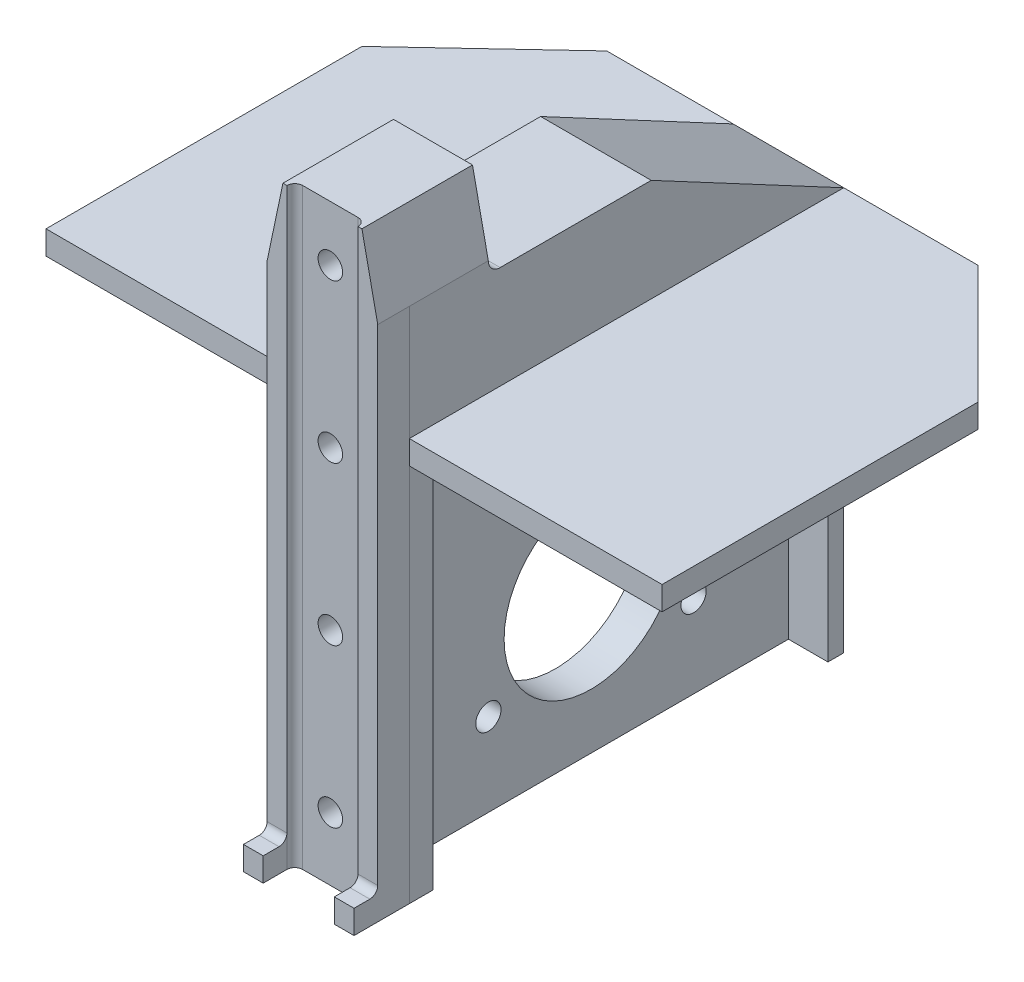
from build123d import *

# Parameters (mm, degrees)
EXTRUDE_2_DEPTH      = 55
SKETCH_5_W           = 50
SKETCH_5_H           = 58
CUT_EXTRUDE_2_DEPTH  = 4.5
SKETCH_6_R           = 11
SKETCH_6_R_2         = 1.6
CUT_EXTRUDE_3_DEPTH  = 4.5
SKETCH_8_W           = 14.000064841
SKETCH_8_H           = 24
EXTRUDE_3_DEPTH      = 55
SKETCH_9_R           = 1.55
CUT_EXTRUDE_4_DEPTH  = 4
CUT_EXTRUDE_8_DEPTH  = 55
CUT_EXTRUDE_12_DEPTH = 15
CUT_EXTRUDE_13_DEPTH = 3
SKETCH_23_W          = 50
SKETCH_23_H          = 58
CUT_EXTRUDE_14_DEPTH = 5
SKETCH_24_W          = 14
SKETCH_24_H          = 10
CUT_EXTRUDE_15_DEPTH = 56
FILLET_1_R           = 2
FILLET_2_R           = 2
FILLET_3_R           = 0.5
CUT_EXTRUDE_16_DEPTH = 11
FILLET_4_R           = 1.5
EXTRUDE_START        = 4
SKETCH_26_R          = 1.55
EXTRUDE_4_DEPTH      = 4
SKETCH_27_W          = 9
SKETCH_27_H          = 75
CUT_EXTRUDE_17_DEPTH = 1
FILLET_5_R           = 1
SKETCH_28_W          = 2.500032421
SKETCH_28_H          = 3
SKETCH_28_W_2        = 2.499970549
EXTRUDE_5_DEPTH      = 3
FILLET_6_R           = 1
SKETCH_29_R          = 1.55
CUT_EXTRUDE_18_DEPTH = 11


# Some blends are built 0.0001 mm under size
with BuildPart() as part:
    # 草图4 → 凸台-拉伸2 (new body)
    with BuildSketch(Plane.XY):
        Polygon((-14.679245283, 23.924528302), (63.320754717, 23.924528302), (63.320754717, 20.924528302), (31.320754717, 20.924528302), (31.320754717, -37.075471698), (17.320754717, -37.075471698), (17.320754717, 20.924528302), (-14.679245283, 20.924528302), align=None)
    extrude(amount=EXTRUDE_2_DEPTH)

    # 草图5 → 切除-拉伸2 (cut)
    with BuildSketch(Plane.ZY.offset(-17.320754717)):
        with Locations((27, -8.075471698)):
            Rectangle(SKETCH_5_W, SKETCH_5_H)
    extrude(amount=-CUT_EXTRUDE_2_DEPTH, mode=Mode.SUBTRACT)

    # 草图6 → 切除-拉伸3 (cut)
    with BuildSketch(Plane.ZY.offset(-21.820754717)):
        with Locations((27, -9.075471698)):
            Circle(SKETCH_6_R)
        with Locations((27, 5.924528302)):
            Circle(SKETCH_6_R_2)
        with Locations((39.990381057, -16.575471698)):
            Circle(SKETCH_6_R_2)
        with Locations((14.009618943, -16.575471698)):
            Circle(SKETCH_6_R_2)
    extrude(amount=-CUT_EXTRUDE_3_DEPTH, mode=Mode.SUBTRACT)

    # 草图8 → 凸台-拉伸3 (add)
    with BuildSketch(Plane.XY.offset(55)):
        with Locations((24.320787138, 35.924528302)):
            Rectangle(SKETCH_8_W, SKETCH_8_H)
    extrude(amount=-EXTRUDE_3_DEPTH)

    # 草图9 → 切除-拉伸4 (cut)
    with BuildSketch(Plane.XY.offset(55)):
        with Locations((24.320784468, 40.924528302)):
            Circle(SKETCH_9_R)
        with Locations((24.320784468, 20.924528302)):
            Circle(SKETCH_9_R)
        with Locations((24.320784468, 0.924528302)):
            Circle(SKETCH_9_R)
        with Locations((24.320784468, -19.075471698)):
            Circle(SKETCH_9_R)
    extrude(amount=-CUT_EXTRUDE_4_DEPTH, mode=Mode.SUBTRACT)

    # 草图13 → 切除-拉伸8 (cut)
    with BuildSketch(Plane.XY.offset(55)):
        Polygon((17.320754717, 47.924528302), (19.320754717, 47.924528302), (17.320754717, 38.424528302), align=None)
        Polygon((29.320819558, 47.924528302), (31.320819558, 47.924528302), (31.320819558, 38.424528302), align=None)
    extrude(amount=-CUT_EXTRUDE_8_DEPTH, mode=Mode.SUBTRACT)

    # 草图20 → 切除-拉伸12 (cut)
    with BuildSketch(Plane(origin=(31.320819558, 0, 0), x_dir=(0, 0, -1), z_dir=(1, 0, 0))):
        Polygon((0, 23.924528302), (0, 47.924528302), (-45, 47.924528302), align=None)
    extrude(amount=-CUT_EXTRUDE_12_DEPTH, mode=Mode.SUBTRACT)

    # 草图21 → 切除-拉伸13 (cut)
    with BuildSketch(Plane(origin=(0, 23.924528302, 0), x_dir=(1, 0, 0), z_dir=(0, 1, 0))):
        Polygon((-14.679245283, 0), (1.320754717, 0), (-14.679245283, -15), align=None)
        Polygon((48.320754717, 0), (63.320754717, 0), (63.320754717, -15), align=None)
    extrude(amount=-CUT_EXTRUDE_13_DEPTH, mode=Mode.SUBTRACT)

    # 草图23 → 切除-拉伸14 (cut)
    with BuildSketch(Plane(origin=(31.320754717, 0, 0), x_dir=(0, 0, -1), z_dir=(1, 0, 0))):
        with Locations((-27, -8.075471698)):
            Rectangle(SKETCH_23_W, SKETCH_23_H)
    extrude(amount=-CUT_EXTRUDE_14_DEPTH, mode=Mode.SUBTRACT)

    # 草图24 → 切除-拉伸15 (cut)
    with BuildSketch(Plane.XY.offset(55)):
        with Locations((24.320754717, -32.075471698)):
            Rectangle(SKETCH_24_W, SKETCH_24_H)
    extrude(amount=-CUT_EXTRUDE_15_DEPTH, mode=Mode.SUBTRACT)

    # 圆角1
    fillet_1_edges = [part.edges().sort_by_distance(p)[0] for p in [
        (21.820754717, 20.924528302, 27),
    ]]
    fillet(fillet_1_edges, radius=FILLET_1_R)

    # 圆角2
    fillet_2_edges = [part.edges().sort_by_distance(p)[0] for p in [
        (26.320754717, 20.924528302, 27),
    ]]
    fillet(fillet_2_edges, radius=FILLET_2_R)

    # 圆角3
    fillet_3_edges = [part.edges().sort_by_distance(p)[0] for p in [
        (21.820754717, -4.075471698, 52),
        (18.570754717, 20.924528302, 52),
        (21.234968279, 20.338741864, 52),
        (26.320754717, -4.075471698, 52),
        (29.820754717, 20.924528302, 52),
        (26.906541155, 20.338741864, 52),
    ]]
    fillet(fillet_3_edges, radius=FILLET_3_R)

    # 草图25 → 切除-拉伸16 (cut)
    with BuildSketch(Plane(origin=(0, 47.924528302, 0), x_dir=(1, 0, 0), z_dir=(0, 1, 0))):
        Polygon((19.320754717, -45), (17.320754717, -45), (17.320754717, -24), (31.320819558, -24), (31.320819558, -45), align=None)
    extrude(amount=-CUT_EXTRUDE_16_DEPTH, mode=Mode.SUBTRACT)

    # 圆角4
    fillet_4_edges = [part.edges().sort_by_distance(p)[0] for p in [
        (24.320787138, 36.924528302, 45),
    ]]
    fillet(fillet_4_edges, radius=FILLET_4_R)

    # 草图26 → 凸台-拉伸4 (add)
    with BuildSketch(Plane.XY.offset(55).offset(EXTRUDE_START)):
        Polygon((17.320754717, -27.075471698), (31.320754717, -27.075471698), (31.320819558, 38.424528302), (29.320819558, 47.924528302), (19.320754717, 47.924528302), (17.320754717, 38.424528302), align=None)
        with Locations((24.320784468, -19.075471698)):
            Circle(SKETCH_26_R, mode=Mode.SUBTRACT)
        with Locations((24.320784468, 0.924528302)):
            Circle(SKETCH_26_R, mode=Mode.SUBTRACT)
        with Locations((24.320784468, 20.924528302)):
            Circle(SKETCH_26_R, mode=Mode.SUBTRACT)
        with Locations((24.320784468, 40.924528302)):
            Circle(SKETCH_26_R, mode=Mode.SUBTRACT)
    extrude(amount=-EXTRUDE_4_DEPTH)

    # 草图27 → 切除-拉伸17 (cut)
    with BuildSketch(Plane.XY.offset(59)):
        with Locations((24.320787138, 10.424528302)):
            Rectangle(SKETCH_27_W, SKETCH_27_H)
    extrude(amount=-CUT_EXTRUDE_17_DEPTH, mode=Mode.SUBTRACT)

    # 圆角5
    fillet_5_edges = [part.edges().sort_by_distance(p)[0] for p in [
        (28.820787138, 10.424528302, 58),
        (19.820787138, 10.424528302, 58),
    ]]
    fillet(fillet_5_edges, radius=FILLET_5_R - 0.0001)  # a hair under: the kernel refuses the full size

    # 草图28 → 凸台-拉伸5 (add)
    with BuildSketch(Plane.XY.offset(59)):
        with Locations((18.570770927, -25.575471698)):
            Rectangle(SKETCH_28_W, SKETCH_28_H)
        with Locations((30.070772412, -25.575471698)):
            Rectangle(SKETCH_28_W_2, SKETCH_28_H)
    extrude(amount=EXTRUDE_5_DEPTH)

    # 圆角6
    # the kernel refuses this fillet: 1 mm, written as the material it adds along each edge
    with BuildSketch(Plane(origin=(19.820787138, -24.075471698, 59), x_dir=(0, 0, 1), z_dir=(-1, 0, 0))) as fillet_6_piece_1:
        with BuildLine():
            CenterArc((FILLET_6_R, FILLET_6_R), FILLET_6_R, 180, 90)
            Line((0, FILLET_6_R), (0, 0))
            Line((0, 0), (FILLET_6_R, 0))
        make_face()
    extrude(amount=2.500032421)
    with BuildSketch(Plane(origin=(33.820757687, -24.075471698, 59), x_dir=(0, 1, 0), z_dir=(-1, 0, 0))) as fillet_6_piece_2_section:
        with BuildLine():
            CenterArc((FILLET_6_R, -FILLET_6_R), FILLET_6_R, 90, 90)
            Line((0, -FILLET_6_R), (0, 0))
            Line((0, 0), (FILLET_6_R, 0))
        make_face()
    fillet_6_piece_2 = extrude(amount=4.999970549, mode=Mode.PRIVATE)
    fillet_6_piece_2 = split(fillet_6_piece_2, bisect_by=Plane(origin=(31.320757908, -23.852105032, 59.223367959), z_dir=(-0.9999999999995101, 9.899447945822129e-07, 0)), keep=Keep.TOP, mode=Mode.PRIVATE)
    add(fillet_6_piece_2)

    # 草图29 → 切除-拉伸18 (cut)
    with BuildSketch(Plane.XY.offset(51)):
        with Locations((24.320784468, 40.924528302)):
            Circle(SKETCH_29_R)
    extrude(amount=-CUT_EXTRUDE_18_DEPTH, mode=Mode.SUBTRACT)


solid = part.part
